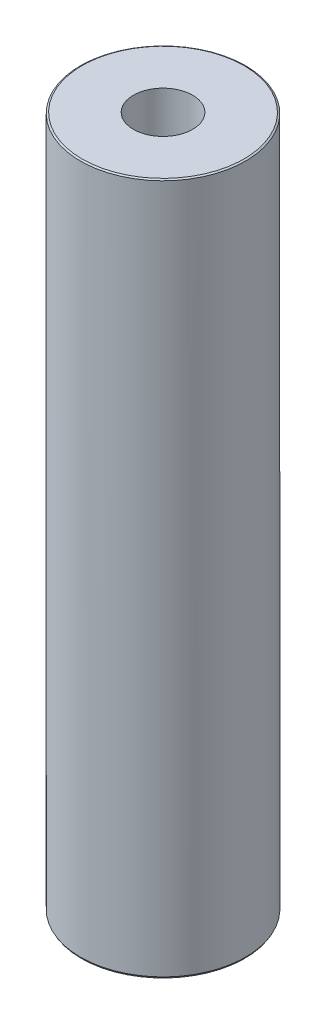
from build123d import *
from OCP.BRepFilletAPI import BRepFilletAPI_MakeChamfer

# Parameters (mm, degrees)
SKETCH1_R           = 25
BOSS_EXTRUDE1_DEPTH = 209.454754336
SKETCH2_R           = 8.960625975
CUT_EXTRUDE1_DEPTH  = 213.417734933
CHAMFER1_SIZE       = 0.288488961
CHAMFER1_SIZE2      = 0.499677539


with BuildPart() as part:
    # Sketch1 → Boss-Extrude1 (new body)
    with BuildSketch(Plane(origin=(0, 0, 0), x_dir=(1, 0, 0), z_dir=(0, 1, 0))):
        Circle(SKETCH1_R)
    extrude(amount=BOSS_EXTRUDE1_DEPTH)

    # Sketch2 → Cut-Extrude1 (cut, through all)
    with BuildSketch(Plane(origin=(0, 0, 0), x_dir=(1, 0, 0), z_dir=(0, 1, 0))):
        Circle(SKETCH2_R)
    extrude(amount=CUT_EXTRUDE1_DEPTH, mode=Mode.SUBTRACT)

    # Chamfer1: one chamfer whose edges measure the first distance from different faces: ONE call of the kernel's chamfer builder (chamfer() names one face for all edges)
    chamfer1_edges_1 = [part.edges().sort_by_distance(p)[0] for p in [
        (-25, 209.454754336, 0),
    ]]
    chamfer1_side_1 = [part.faces().sort_by_distance(p)[0] for p in [
        (-25, 104.727377168, 0),
    ]]
    chamfer1_edges_2 = [part.edges().sort_by_distance(p)[0] for p in [
        (-25, 0, 0),
    ]]
    chamfer1_side_2 = [part.faces().sort_by_distance(p)[0] for p in [
        (-24.292893219, 0, 0),
    ]]
    chamfer1 = BRepFilletAPI_MakeChamfer(part.part.solid().wrapped)
    for e in chamfer1_edges_1:
        chamfer1.Add(CHAMFER1_SIZE, CHAMFER1_SIZE2, e.wrapped, chamfer1_side_1[0].wrapped)  # the first distance lies on this face
    for e in chamfer1_edges_2:
        chamfer1.Add(CHAMFER1_SIZE, CHAMFER1_SIZE2, e.wrapped, chamfer1_side_2[0].wrapped)  # the first distance lies on this face
    add(Compound.cast(chamfer1.Shape()), mode=Mode.REPLACE)


solid = part.part
